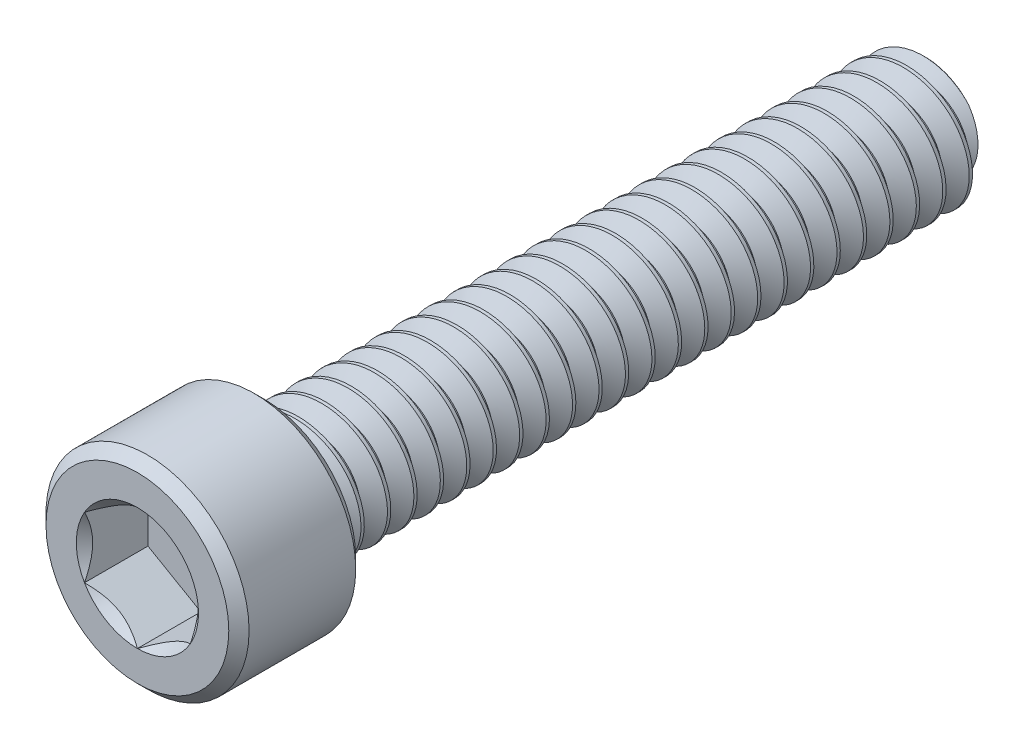
from build123d import *

# Parameters (mm, degrees)
CUT_EXTRUDE1_DEPTH = 0.762
CUT_SWEEP1_PITCH   = 0.3175


# Read off the part's stored shape, not the designer's step: Split1
with BuildPart() as part:
    # Sketch2 → Revolve1 (revolve)
    with BuildSketch(Plane(origin=(0, 0, 0), x_dir=(0, 0, -1), z_dir=(1, 0, 0)), mode=Mode.PRIVATE) as revolve1_sk:
        Polygon((7.9375, 0.6858), (7.8613, 0.762), (0, 0.762), (0, 1.09728), (-0.12192, 1.2192), (-1.40208, 1.2192), (-1.524, 1.09728), (-1.524, 0.635), (-0.762, 0.635), (-0.762, 0), (7.9375, 0), align=None)
    revolve(revolve1_sk.sketch.rotate(Axis((0, 0, 0.762), (0, 0, -1)), 90), axis=Axis((0, 0, 0.762), (0, 0, -1)))

    # Sketch3 → Cut-Extrude1 (cut)
    with BuildSketch(Plane.XY.offset(1.524)):
        Polygon((0, 0.733234842), (-0.635, 0.366617421), (-0.635, -0.366617421), (0, -0.733234842), (0.635, -0.366617421), (0.635, 0.366617421), align=None)
    extrude(amount=-CUT_EXTRUDE1_DEPTH, mode=Mode.SUBTRACT)

    # Cut-Extrude2 cone 1 section (through the dimple's axis) → Cut-Extrude2 (revolve, cut)
    with BuildSketch(Plane(origin=(0, 0, 1.524), x_dir=(0, -1, 0), z_dir=(1, 0, 0))):
        Polygon((0, 0), (0.733234842, 0), (0, 0.733234842), align=None)
    revolve(axis=Axis((0, 0, 1.524), (0, 0, -1)), mode=Mode.SUBTRACT)


with BuildPart() as body_2:
    # Split1: the piece on the far side of the plane
    add(part.part)
    split(bisect_by=Plane.XY, keep=Keep.BOTTOM)

    # Cut-Sweep1: the profile of Sketch7 screwed along a right-hand helix of 26 turns, 6 arcs to a turn; built about Z, then put on its axis
    cut_sweep1_z = Axis((0, 0, 0), (0, 0, 1))
    cut_sweep1_corners = [(0.779185192, 0, -0.287734375), (0.796370383, 0, 0.01984375), (0.555777701, 0, -0.1190625), (0.555777701, 0, -0.15875)]
    with BuildLine(mode=Mode.PRIVATE) as cut_sweep1_profile:
        Line(cut_sweep1_corners[0], cut_sweep1_corners[1])
        Line(cut_sweep1_corners[1], cut_sweep1_corners[2])
        Line(cut_sweep1_corners[2], cut_sweep1_corners[3])
        Line(cut_sweep1_corners[3], cut_sweep1_corners[0])
    cut_sweep1_cap = Face(cut_sweep1_profile.wire())
    cut_sweep1_turn_angles = [0, 30, 60, 90, 120, 150, 180, 210, 240, 270, 300, 330, 360]
    cut_sweep1_turn_weights = [1, 0.8660254037844387, 1, 0.8660254037844387, 1, 0.8660254037844387, 1, 0.8660254037844387, 1, 0.8660254037844387, 1, 0.8660254037844387, 1]
    cut_sweep1_turn_rails = [Edge.make_bspline([Vector(p[0], p[1], 0).rotate(cut_sweep1_z, cut_sweep1_turn_angles[k]) / cut_sweep1_turn_weights[k] + Vector(0, 0, p[2] + CUT_SWEEP1_PITCH * cut_sweep1_turn_angles[k] / 360) for k in range(13)], [0, 0, 0, 1, 1, 2, 2, 3, 3, 4, 4, 5, 5, 6, 6, 6], 2, cut_sweep1_turn_weights) for p in cut_sweep1_corners]
    cut_sweep1_turn_sides = [Face.make_surface_from_curves(cut_sweep1_turn_rails[p[0]], cut_sweep1_turn_rails[p[1]]) for p in [(0, 1), (1, 2), (2, 3), (3, 0)]]
    cut_sweep1_turn = Solid(Shell([*cut_sweep1_turn_sides, cut_sweep1_cap, cut_sweep1_cap.rotate(cut_sweep1_z, 360).moved(Location((0, 0, CUT_SWEEP1_PITCH * 360 / 360)))]))
    cut_sweep1_each = [*[cut_sweep1_turn.moved(Location((0, 0, CUT_SWEEP1_PITCH * i))) for i in range(26)]]
    add(Plane(origin=(0, 0, 0), x_dir=(0, 1, 0), z_dir=(0, 0, -1)) * Compound([cut_sweep1_each[i] for i in range(0, 26, 2)]), mode=Mode.SUBTRACT)
    add(Plane(origin=(0, 0, 0), x_dir=(0, 1, 0), z_dir=(0, 0, -1)) * Compound([cut_sweep1_each[i] for i in range(1, 26, 2)]), mode=Mode.SUBTRACT)


with BuildPart() as part_1:
    add(part.part)

    # Split1
    split(bisect_by=Plane.XY, keep=Keep.TOP)

    # Combine1: union body 2
    add(body_2.part)


solid = part_1.part
